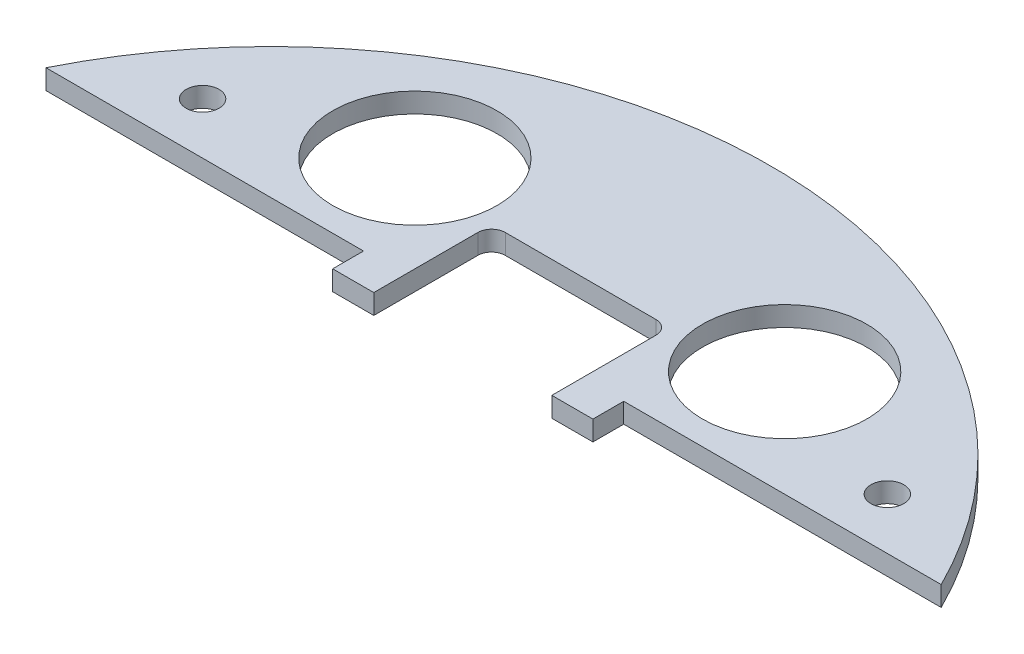
from build123d import *

# Parameters (mm, degrees)
BOSS_EXTRUDE1_DEPTH     = 2.9
SOLENOID_PLACEMENT_W    = 38
SOLENOID_PLACEMENT_H    = 64
CUT_EXTRUDE1_DEPTH      = 104.278313309
CUT_EXTRUDE4_DEPTH      = 104.278313309
SKETCH5_R               = 12
CUT_EXTRUDE5_DEPTH      = 104.278313309
SKETCH6_R               = 2.4
CUT_EXTRUDE6_DEPTH      = 104.278313309
CUT_EXTRUDE3_DEPTH      = 104.278313309
CUT_EXTRUDE9_DEPTH      = 99.031423533
CUT_EXTRUDE9_DEPTH_BACK = 99.031423533
SKETCH8_W               = 10
SKETCH8_H               = 62.80248699


with BuildPart() as part:
    # Sketch1 → Boss-Extrude1 (new body)
    with BuildSketch(Plane(origin=(0, 0, 0), x_dir=(1, 0, 0), z_dir=(0, 1, 0))):
        with BuildLine():
            ThreePointArc((36.856602833, -63.012624351), (0, 73), (-36.856602833, -63.012624351))
            ThreePointArc((-36.856602833, -63.012624351), (-33.368752207, -63.602994345), (-30.363140064, -61.737536127))
            ThreePointArc((-30.363140064, -61.737536127), (0, -46.75), (30.363140064, -61.737536127))
            ThreePointArc((30.363140064, -61.737536127), (33.368752207, -63.602994345), (36.856602833, -63.012624351))
        make_face()
    extrude(amount=BOSS_EXTRUDE1_DEPTH)

    # solenoid placement → Cut-Extrude1 (cut, through all)
    with BuildSketch(Plane(origin=(0, 2.9, 0), x_dir=(1, 0, 0), z_dir=(0, 1, 0))):
        with Locations((0, -4)):
            Rectangle(SOLENOID_PLACEMENT_W, SOLENOID_PLACEMENT_H)
    extrude(amount=-CUT_EXTRUDE1_DEPTH, mode=Mode.SUBTRACT)

    # Sketch4 → Cut-Extrude4 (cut, through all)
    with BuildSketch(Plane(origin=(0, 2.9, 0), x_dir=(1, 0, 0), z_dir=(0, 1, 0))):
        with BuildLine():
            Line((-13, 28), (13, 28))
            Line((13, 28), (13, 43.2))
            ThreePointArc((13, 43.2), (12.414213562, 44.614213562), (11, 45.2))
            Line((11, 45.2), (-11, 45.2))
            ThreePointArc((-11, 45.2), (-12.414213562, 44.614213562), (-13, 43.2))
            Line((-13, 43.2), (-13, 28))
        make_face()
    extrude(amount=-CUT_EXTRUDE4_DEPTH, mode=Mode.SUBTRACT)

    # Sketch5 → Cut-Extrude5 (cut, through all)
    with BuildSketch(Plane(origin=(0, 2.9, 0), x_dir=(1, 0, 0), z_dir=(0, 1, 0))):
        with Locations((-27, 48)):
            Circle(SKETCH5_R)
        with Locations((27, 48)):
            Circle(SKETCH5_R)
    extrude(amount=-CUT_EXTRUDE5_DEPTH, mode=Mode.SUBTRACT)

    # Sketch6 → Cut-Extrude6 (cut, through all)
    with BuildSketch(Plane(origin=(0, 2.9, 0), x_dir=(1, 0, 0), z_dir=(0, 1, 0))):
        with Locations((40, -40)):
            Circle(SKETCH6_R)
        with Locations((-40, -40)):
            Circle(SKETCH6_R)
        with Locations((-50, 40)):
            Circle(SKETCH6_R)
        with Locations((50, 40)):
            Circle(SKETCH6_R)
    extrude(amount=-CUT_EXTRUDE6_DEPTH, mode=Mode.SUBTRACT)

    # Sketch3 → Cut-Extrude3 (cut, through all)
    with BuildSketch(Plane(origin=(0, 2.9, 0), x_dir=(1, 0, 0), z_dir=(0, 1, 0))):
        Polygon((-19, 28), (19, 28), (19, 32.5), (73, 32.5), (73, -32.5), (-73, -32.5), (-73, 32.5), (-19, 32.5), align=None)
    extrude(amount=-CUT_EXTRUDE3_DEPTH, mode=Mode.SUBTRACT)


with BuildPart() as cut_extrude3_piece_1:
    # of the separate pieces the step leaves, piece 1, a body of its own (cut_extrude3_pieces)
    add(part.part.solids().sort_by_distance((65.366275709, 0, -32.5))[0])


with BuildPart() as cut_extrude3_piece_2:
    # of the separate pieces the step leaves, piece 2, a body of its own (cut_extrude3_pieces)
    add(part.part.solids().sort_by_distance((-36.856602833, 0, 63.012624351))[0])

    # Sketch8 → Cut-Extrude9 (cut, two sides: drawn at the far end of the back side and taken through both)
    with BuildSketch(Plane(origin=(0, 2.9, 0), x_dir=(1, 0, 0), z_dir=(0, 1, 0)).offset(-CUT_EXTRUDE9_DEPTH_BACK)):
        with Locations((0, -31.401243495)):
            Rectangle(SKETCH8_W, SKETCH8_H)
    extrude(amount=CUT_EXTRUDE9_DEPTH + CUT_EXTRUDE9_DEPTH_BACK, mode=Mode.SUBTRACT)


with BuildPart() as cut_extrude9_piece_1:
    # of the separate pieces the step leaves, piece 1, a body of its own (cut_extrude9_pieces)
    add(cut_extrude3_piece_2.part.solids().sort_by_distance((5, 0, 47.078205475))[0])


with BuildPart() as cut_extrude9_piece_2:
    # of the separate pieces the step leaves, piece 2, a body of its own (cut_extrude9_pieces)
    add(cut_extrude3_piece_2.part.solids().sort_by_distance((-36.856602833, 0, 63.012624351))[0])


solid = cut_extrude3_piece_1.part
